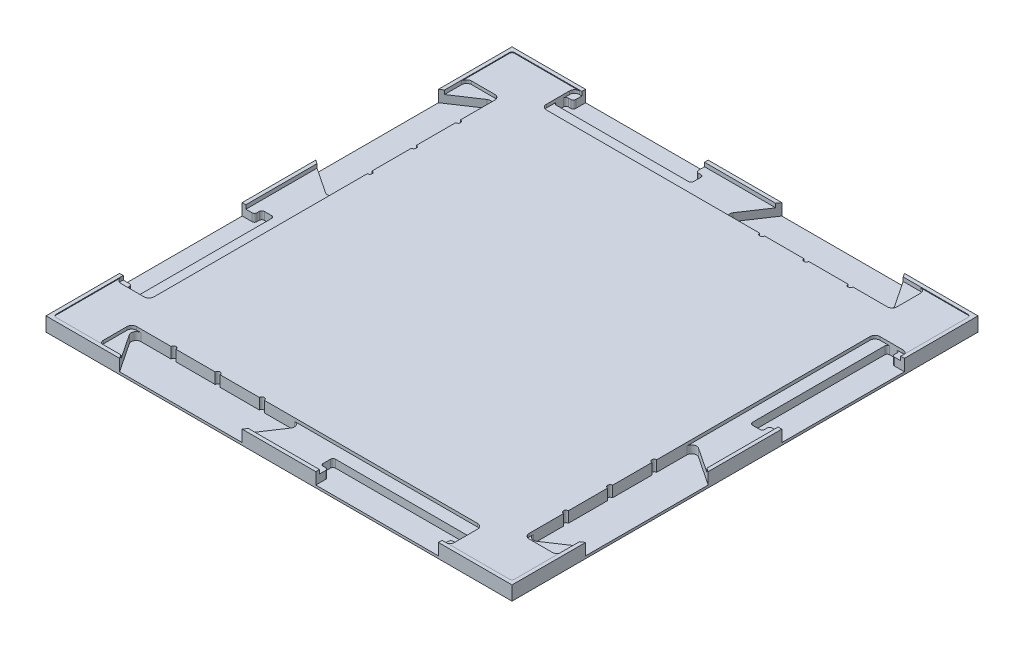
from build123d import *

# Parameters (mm, degrees)
SKETCH1_W           = 190
SKETCH1_H           = 190
BOSS_EXTRUDE1_DEPTH = 2.875
SKETCH2_W           = 187
SKETCH2_H           = 187
CUT_EXTRUDE1_DEPTH  = 0.3
CUT_EXTRUDE2_START  = -4.75
CUT_EXTRUDE2_DEPTH  = 140.223278015
CUT_EXTRUDE4_DEPTH  = 4.45
SKETCH9_W           = 143
SKETCH9_H           = 13.5
CUT_EXTRUDE5_DEPTH  = 1.3
FILLET1_R           = 1
FILLET3_R           = 2
FILLET4_R           = 2
CIRPATTERN1_START   = -1.875
CIRPATTERN1_DEPTH   = 4.75
CIRPATTERN1_START_2 = 1.275
CIRPATTERN1_2_DEPTH = 1.3


# Read off the part's stored shape, not the designer's step: CirPattern1
with BuildPart() as part:
    # Sketch1 → Boss-Extrude1 (new, symmetric)
    with BuildSketch(Plane(origin=(0, 0, 0), x_dir=(1, 0, 0), z_dir=(0, 1, 0))):
        Rectangle(SKETCH1_W, SKETCH1_H)
    extrude(amount=BOSS_EXTRUDE1_DEPTH, both=True)

    # Sketch2 → Cut-Extrude1 (cut)
    with BuildSketch(Plane(origin=(0, 2.875, 0), x_dir=(1, 0, 0), z_dir=(0, 1, 0))):
        Rectangle(SKETCH2_W, SKETCH2_H)
    extrude(amount=-CUT_EXTRUDE1_DEPTH, mode=Mode.SUBTRACT)

    # Sketch4 → Cut-Extrude2 (cut)
    with BuildSketch(Plane(origin=(0, 2.875, 0), x_dir=(1, 0, 0), z_dir=(0, 1, 0)).offset(CUT_EXTRUDE2_START)):
        Polygon((-65, -95), (-75, -80), (-5, -80), (-15, -95), align=None)
        Polygon((15, -95), (15, -90), (12, -90), (12, -85), (68, -85), (68, -90), (65, -90), (65, -95), align=None)
    extrude(amount=CUT_EXTRUDE2_DEPTH, mode=Mode.SUBTRACT)

    # Sketch6 → Cut-Extrude4 (cut)
    with BuildSketch(Plane(origin=(0, 2.575, 0), x_dir=(1, 0, 0), z_dir=(0, 1, 0))):
        with BuildLine():
            Line((-59, -80), (-57, -80))
            ThreePointArc((-57, -80), (-58, -79), (-59, -80))
        make_face()
        with BuildLine():
            Line((-41, -80), (-39, -80))
            ThreePointArc((-39, -80), (-40, -79), (-41, -80))
        make_face()
        with BuildLine():
            Line((-23, -80), (-21, -80))
            ThreePointArc((-21, -80), (-22, -79), (-23, -80))
        make_face()
    extrude(amount=-CUT_EXTRUDE4_DEPTH, mode=Mode.SUBTRACT)

    # Sketch9 → Cut-Extrude5 (cut)
    with BuildSketch(Plane(origin=(0, 2.575, 0), x_dir=(1, 0, 0), z_dir=(0, 1, 0))):
        with Locations((-3.5, -86.75)):
            Rectangle(SKETCH9_W, SKETCH9_H)
    extrude(amount=-CUT_EXTRUDE5_DEPTH, mode=Mode.SUBTRACT)

    # Fillet1
    fillet1_edges = [part.edges().sort_by_distance(p)[0] for p in [
        (-93.5, 2.725, -93.5),
        (-93.5, 2.725, 93.5),
        (93.5, 2.725, 93.5),
        (93.5, 2.725, -93.5),
        (68, -0.3, 90),
        (68, -0.3, 85),
        (12, -0.3, 85),
        (12, -0.3, 90),
        (15, -0.3, 90),
        (65, -0.3, 90),
    ]]
    fillet(fillet1_edges, radius=FILLET1_R)

    # Fillet3
    fillet3_edges = [part.edges().sort_by_distance(p)[0] for p in [
        (-75, -0.3, 80),
        (-5, -0.3, 80),
    ]]
    fillet(fillet3_edges, radius=FILLET3_R)

    # Fillet4
    fillet4_edges = [part.edges().sort_by_distance(p)[0] for p in [
        (68, 1.925, 80),
        (68, 1.925, 93.5),
        (-75, 1.925, 80),
        (-75, 1.925, 93.5),
    ]]
    fillet(fillet4_edges, radius=FILLET4_R)

    # CirPattern1 outline → CirPattern1 (cut)
    with BuildSketch(Plane(origin=(0, 0, 0), x_dir=(1, 0, 0), z_dir=(0, 1, 0)).offset(CIRPATTERN1_START)):
        with BuildLine():
            ThreePointArc((80, -21), (79, -22), (80, -23))
            Line((80, -23), (80, -39))
            ThreePointArc((80, -39), (79, -40), (80, -41))
            Line((80, -41), (80, -57))
            ThreePointArc((80, -57), (79, -58), (80, -59))
            Line((80, -59), (80, -71.262965816))
            ThreePointArc((80, -71.262965816), (81.056284149, -73.026315014), (83.109400392, -72.927066405))
            Line((83.109400392, -72.927066405), (95, -65))
            Line((95, -65), (95, -15))
            Line((95, -15), (83.109400392, -7.072933595))
            ThreePointArc((83.109400392, -7.072933595), (81.056284149, -6.973684986), (80, -8.737034184))
            Line((80, -8.737034184), (80, -21))
        make_face()
        with BuildLine():
            Line((-95, 65), (-95, 15))
            Line((-95, 15), (-83.109400392, 7.072933595))
            ThreePointArc((-83.109400392, 7.072933595), (-81.056284149, 6.973684986), (-80, 8.737034184))
            Line((-80, 8.737034184), (-80, 21))
            ThreePointArc((-80, 21), (-79, 22), (-80, 23))
            Line((-80, 23), (-80, 39))
            ThreePointArc((-80, 39), (-79, 40), (-80, 41))
            Line((-80, 41), (-80, 57))
            ThreePointArc((-80, 57), (-79, 58), (-80, 59))
            Line((-80, 59), (-80, 71.262965816))
            ThreePointArc((-80, 71.262965816), (-81.056284149, 73.026315014), (-83.109400392, 72.927066405))
            Line((-83.109400392, 72.927066405), (-95, 65))
        make_face()
        with BuildLine():
            Line((65, 95), (15, 95))
            Line((15, 95), (7.072933595, 83.109400392))
            ThreePointArc((7.072933595, 83.109400392), (6.973684986, 81.056284149), (8.737034184, 80))
            Line((8.737034184, 80), (21, 80))
            ThreePointArc((21, 80), (22, 79), (23, 80))
            Line((23, 80), (39, 80))
            ThreePointArc((39, 80), (40, 79), (41, 80))
            Line((41, 80), (57, 80))
            ThreePointArc((57, 80), (58, 79), (59, 80))
            Line((59, 80), (71.262965816, 80))
            ThreePointArc((71.262965816, 80), (73.026315014, 81.056284149), (72.927066405, 83.109400392))
            Line((72.927066405, 83.109400392), (65, 95))
        make_face()
        with BuildLine():
            Line((89, 68), (86, 68))
            ThreePointArc((86, 68), (85.292893219, 67.707106781), (85, 67))
            Line((85, 67), (85, 13))
            ThreePointArc((85, 13), (85.292893219, 12.292893219), (86, 12))
            Line((86, 12), (89, 12))
            ThreePointArc((89, 12), (89.707106781, 12.292893219), (90, 13))
            Line((90, 13), (90, 14))
            ThreePointArc((90, 14), (90.292893219, 14.707106781), (91, 15))
            Line((91, 15), (95, 15))
            Line((95, 15), (95, 65))
            Line((95, 65), (91, 65))
            ThreePointArc((91, 65), (90.292893219, 65.292893219), (90, 66))
            Line((90, 66), (90, 67))
            ThreePointArc((90, 67), (89.707106781, 67.707106781), (89, 68))
        make_face()
        with BuildLine():
            Line((-15, 95), (-65, 95))
            Line((-65, 95), (-65, 91))
            ThreePointArc((-65, 91), (-65.292893219, 90.292893219), (-66, 90))
            Line((-66, 90), (-67, 90))
            ThreePointArc((-67, 90), (-67.707106781, 89.707106781), (-68, 89))
            Line((-68, 89), (-68, 86))
            ThreePointArc((-68, 86), (-67.707106781, 85.292893219), (-67, 85))
            Line((-67, 85), (-13, 85))
            ThreePointArc((-13, 85), (-12.292893219, 85.292893219), (-12, 86))
            Line((-12, 86), (-12, 89))
            ThreePointArc((-12, 89), (-12.292893219, 89.707106781), (-13, 90))
            Line((-13, 90), (-14, 90))
            ThreePointArc((-14, 90), (-14.707106781, 90.292893219), (-15, 91))
            Line((-15, 91), (-15, 95))
        make_face()
        with BuildLine():
            Line((-95, -15), (-95, -65))
            Line((-95, -65), (-91, -65))
            ThreePointArc((-91, -65), (-90.292893219, -65.292893219), (-90, -66))
            Line((-90, -66), (-90, -67))
            ThreePointArc((-90, -67), (-89.707106781, -67.707106781), (-89, -68))
            Line((-89, -68), (-86, -68))
            ThreePointArc((-86, -68), (-85.292893219, -67.707106781), (-85, -67))
            Line((-85, -67), (-85, -13))
            ThreePointArc((-85, -13), (-85.292893219, -12.292893219), (-86, -12))
            Line((-86, -12), (-89, -12))
            ThreePointArc((-89, -12), (-89.707106781, -12.292893219), (-90, -13))
            Line((-90, -13), (-90, -14))
            ThreePointArc((-90, -14), (-90.292893219, -14.707106781), (-91, -15))
            Line((-91, -15), (-95, -15))
        make_face()
    extrude(amount=CIRPATTERN1_DEPTH, mode=Mode.SUBTRACT)

    # CirPattern1 2 outline → CirPattern1 2 (cut)
    with BuildSketch(Plane(origin=(0, 0, 0), x_dir=(1, 0, 0), z_dir=(0, 1, 0)).offset(CIRPATTERN1_START_2)):
        with BuildLine():
            Line((80, 66), (80, -8.737034184))
            ThreePointArc((80, -8.737034184), (81.056284149, -6.973684986), (83.109400392, -7.072933595))
            Line((83.109400392, -7.072933595), (93.5, -14))
            Line((93.5, -14), (93.5, 15))
            Line((93.5, 15), (91, 15))
            ThreePointArc((91, 15), (90.292893219, 14.707106781), (90, 14))
            Line((90, 14), (90, 13))
            ThreePointArc((90, 13), (89.707106781, 12.292893219), (89, 12))
            Line((89, 12), (86, 12))
            ThreePointArc((86, 12), (85.292893219, 12.292893219), (85, 13))
            Line((85, 13), (85, 67))
            ThreePointArc((85, 67), (85.292893219, 67.707106781), (86, 68))
            Line((86, 68), (82, 68))
            ThreePointArc((82, 68), (80.585786438, 67.414213562), (80, 66))
        make_face()
        with BuildLine():
            ThreePointArc((83.109400392, -72.927066405), (81.056284149, -73.026315014), (80, -71.262965816))
            Line((80, -71.262965816), (80, -73))
            ThreePointArc((80, -73), (80.585786438, -74.414213562), (82, -75))
            Line((82, -75), (91.5, -75))
            ThreePointArc((91.5, -75), (92.914213562, -74.414213562), (93.5, -73))
            Line((93.5, -73), (93.5, -66))
            Line((93.5, -66), (83.109400392, -72.927066405))
        make_face()
        with BuildLine():
            Line((91.5, 68), (89, 68))
            ThreePointArc((89, 68), (89.707106781, 67.707106781), (90, 67))
            Line((90, 67), (90, 66))
            ThreePointArc((90, 66), (90.292893219, 65.292893219), (91, 65))
            Line((91, 65), (93.5, 65))
            Line((93.5, 65), (93.5, 66))
            ThreePointArc((93.5, 66), (92.914213562, 67.414213562), (91.5, 68))
        make_face()
        with BuildLine():
            Line((73, 93.5), (66, 93.5))
            Line((66, 93.5), (72.927066405, 83.109400392))
            ThreePointArc((72.927066405, 83.109400392), (73.026315014, 81.056284149), (71.262965816, 80))
            Line((71.262965816, 80), (73, 80))
            ThreePointArc((73, 80), (74.414213562, 80.585786438), (75, 82))
            Line((75, 82), (75, 91.5))
            ThreePointArc((75, 91.5), (74.414213562, 92.914213562), (73, 93.5))
        make_face()
        with BuildLine():
            Line((7.072933595, 83.109400392), (14, 93.5))
            Line((14, 93.5), (-15, 93.5))
            Line((-15, 93.5), (-15, 91))
            ThreePointArc((-15, 91), (-14.707106781, 90.292893219), (-14, 90))
            Line((-14, 90), (-13, 90))
            ThreePointArc((-13, 90), (-12.292893219, 89.707106781), (-12, 89))
            Line((-12, 89), (-12, 86))
            ThreePointArc((-12, 86), (-12.292893219, 85.292893219), (-13, 85))
            Line((-13, 85), (-67, 85))
            ThreePointArc((-67, 85), (-67.707106781, 85.292893219), (-68, 86))
            Line((-68, 86), (-68, 82))
            ThreePointArc((-68, 82), (-67.414213562, 80.585786438), (-66, 80))
            Line((-66, 80), (8.737034184, 80))
            ThreePointArc((8.737034184, 80), (6.973684986, 81.056284149), (7.072933595, 83.109400392))
        make_face()
        with BuildLine():
            Line((-65, 91), (-65, 93.5))
            Line((-65, 93.5), (-66, 93.5))
            ThreePointArc((-66, 93.5), (-67.414213562, 92.914213562), (-68, 91.5))
            Line((-68, 91.5), (-68, 89))
            ThreePointArc((-68, 89), (-67.707106781, 89.707106781), (-67, 90))
            Line((-67, 90), (-66, 90))
            ThreePointArc((-66, 90), (-65.292893219, 90.292893219), (-65, 91))
        make_face()
        with BuildLine():
            Line((-93.5, 73), (-93.5, 66))
            Line((-93.5, 66), (-83.109400392, 72.927066405))
            ThreePointArc((-83.109400392, 72.927066405), (-81.056284149, 73.026315014), (-80, 71.262965816))
            Line((-80, 71.262965816), (-80, 73))
            ThreePointArc((-80, 73), (-80.585786438, 74.414213562), (-82, 75))
            Line((-82, 75), (-91.5, 75))
            ThreePointArc((-91.5, 75), (-92.914213562, 74.414213562), (-93.5, 73))
        make_face()
        with BuildLine():
            Line((-83.109400392, 7.072933595), (-93.5, 14))
            Line((-93.5, 14), (-93.5, -15))
            Line((-93.5, -15), (-91, -15))
            ThreePointArc((-91, -15), (-90.292893219, -14.707106781), (-90, -14))
            Line((-90, -14), (-90, -13))
            ThreePointArc((-90, -13), (-89.707106781, -12.292893219), (-89, -12))
            Line((-89, -12), (-86, -12))
            ThreePointArc((-86, -12), (-85.292893219, -12.292893219), (-85, -13))
            Line((-85, -13), (-85, -67))
            ThreePointArc((-85, -67), (-85.292893219, -67.707106781), (-86, -68))
            Line((-86, -68), (-82, -68))
            ThreePointArc((-82, -68), (-80.585786438, -67.414213562), (-80, -66))
            Line((-80, -66), (-80, 8.737034184))
            ThreePointArc((-80, 8.737034184), (-81.056284149, 6.973684986), (-83.109400392, 7.072933595))
        make_face()
        with BuildLine():
            Line((-91, -65), (-93.5, -65))
            Line((-93.5, -65), (-93.5, -66))
            ThreePointArc((-93.5, -66), (-92.914213562, -67.414213562), (-91.5, -68))
            Line((-91.5, -68), (-89, -68))
            ThreePointArc((-89, -68), (-89.707106781, -67.707106781), (-90, -67))
            Line((-90, -67), (-90, -66))
            ThreePointArc((-90, -66), (-90.292893219, -65.292893219), (-91, -65))
        make_face()
    extrude(amount=CIRPATTERN1_2_DEPTH, mode=Mode.SUBTRACT)


solid = part.part
